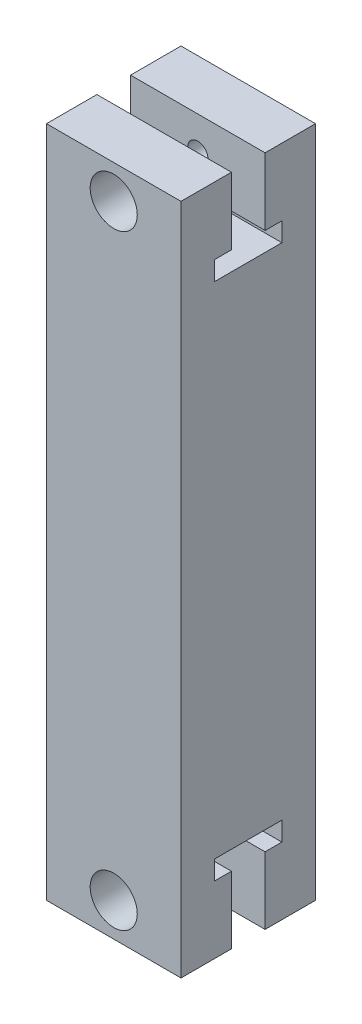
from build123d import *

# Parameters (mm, degrees)
BOSS_EXTRUDE1_DEPTH      = 50
BOSS_EXTRUDE1_DEPTH_BACK = 50
SKETCH1_W                = 20
SKETCH1_H                = 20
CUT_EXTRUDE2_DEPTH       = 58.445626465
SKETCH4_R                = 1.5
CUT_EXTRUDE3_DEPTH       = 58.445626465
SKETCH5_R                = 3.5
CUT_EXTRUDE4_DEPTH       = 5
CUT_EXTRUDE5_START       = -5
SKETCH6_R                = 3.5
CUT_EXTRUDE5_DEPTH       = 5


with BuildPart() as part:
    # Sketch1 → Boss-Extrude1 (new, two sides: drawn at the far end of the back side and taken through both)
    with BuildSketch(Plane(origin=(0, 0, 0), x_dir=(1, 0, 0), z_dir=(0, 1, 0)).offset(-BOSS_EXTRUDE1_DEPTH_BACK)):
        with Locations((10, -10)):
            Rectangle(SKETCH1_W, SKETCH1_H)
    extrude(amount=BOSS_EXTRUDE1_DEPTH + BOSS_EXTRUDE1_DEPTH_BACK)

    # Sketch3 → Cut-Extrude2 (cut, through all)
    with BuildSketch(Plane.ZY):
        Polygon((7.5, 40), (5, 40), (5, 37.171225458), (15, 37.171225458), (15, 40), (12.5, 40), (12.5, 50), (10, 50), (7.5, 50), align=None)
        Polygon((5, -37.171225458), (5, -40), (7.5, -40), (7.5, -50), (10, -50), (12.5, -50), (12.5, -40), (15, -40), (15, -37.171225458), align=None)
    extrude(amount=-CUT_EXTRUDE2_DEPTH, mode=Mode.SUBTRACT)

    # Sketch4 → Cut-Extrude3 (cut, through all)
    with BuildSketch(Plane(origin=(0, 0, 0), x_dir=(-1, 0, 0), z_dir=(0, 0, -1))):
        with Locations((-10, -45)):
            Circle(SKETCH4_R)
        with Locations((-10, 45)):
            Circle(SKETCH4_R)
    extrude(amount=-CUT_EXTRUDE3_DEPTH, mode=Mode.SUBTRACT)

    # Sketch5 → Cut-Extrude4 (cut)
    with BuildSketch(Plane(origin=(0, 0, 0), x_dir=(-1, 0, 0), z_dir=(0, 0, -1))):
        with Locations((-10, -45)):
            Circle(SKETCH5_R)
        with Locations((-10, 45)):
            Circle(SKETCH5_R)
    extrude(amount=-CUT_EXTRUDE4_DEPTH, mode=Mode.SUBTRACT)

    # Sketch6 → Cut-Extrude5 (cut)
    with BuildSketch(Plane.XY.offset(20).offset(CUT_EXTRUDE5_START)):
        with Locations((10, -45)):
            Circle(SKETCH6_R)
        with Locations((10, 45)):
            Circle(SKETCH6_R)
    extrude(amount=CUT_EXTRUDE5_DEPTH, mode=Mode.SUBTRACT)


solid = part.part
